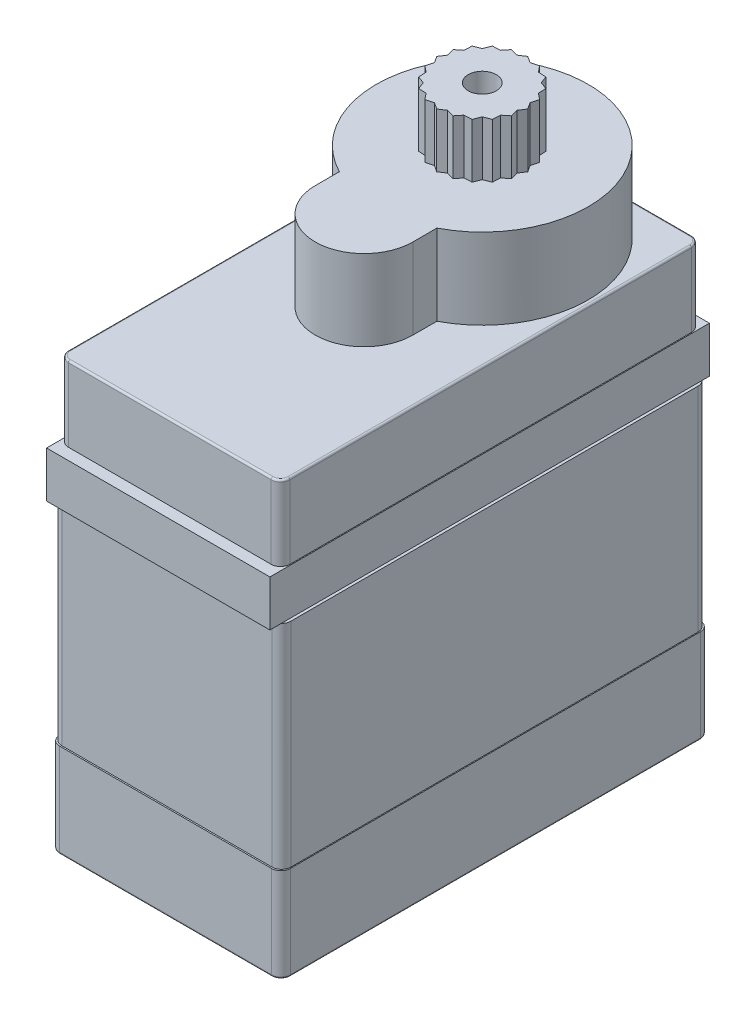
from build123d import *

# Parameters (mm, degrees)
Y_KSEKLIK_EKSTR_ZYON1_DEPTH = 5
Y_KSEKLIK_EKSTR_ZYON2_DEPTH = 11.35
Y_KSEKLIK_EKSTR_ZYON3_DEPTH = 2.45
Y_KSEKLIK_EKSTR_ZYON4_DEPTH = 4
IZIM5_R                     = 5.65
Y_KSEKLIK_EKSTR_ZYON5_DEPTH = 4.3
IZIM7_R                     = 0.75
Y_KSEKLIK_EKSTR_ZYON6_DEPTH = 2.9
RADYUS1_R                   = 0.1
IZIM8_R                     = 0.6
Y_KSEKLIK_EKSTR_ZYON7_DEPTH = 3
SKETCH1_OUTSIDE_W           = 23.446
SKETCH1_OUTSIDE_H           = 43.396
SKETCH1_OUTSIDE_W_2         = 11.9
SKETCH1_OUTSIDE_H_2         = 23.420918094
CUT_EXTRUDE1_DEPTH          = 2.45


with BuildPart() as part:
    # Çizim1 → Yükseklik-Ekstrüzyon1 (new body)
    with BuildSketch(Plane(origin=(0, 0, 0), x_dir=(1, 0, 0), z_dir=(0, 1, 0))):
        with BuildLine():
            Line((-5.65, -11.425), (5.65, -11.425))
            ThreePointArc((5.65, -11.425), (6.003553391, -11.278553391), (6.15, -10.925))
            Line((6.15, -10.925), (6.15, 10.925))
            ThreePointArc((6.15, 10.925), (6.003553391, 11.278553391), (5.65, 11.425))
            Line((5.65, 11.425), (-5.65, 11.425))
            ThreePointArc((-5.65, 11.425), (-6.003553391, 11.278553391), (-6.15, 10.925))
            Line((-6.15, 10.925), (-6.15, -10.925))
            ThreePointArc((-6.15, -10.925), (-6.003553391, -11.278553391), (-5.65, -11.425))
        make_face()
    extrude(amount=Y_KSEKLIK_EKSTR_ZYON1_DEPTH)

    # Çizim2 → Yükseklik-Ekstrüzyon2 (add)
    with BuildSketch(Plane(origin=(0, 5, 0), x_dir=(1, 0, 0), z_dir=(0, 1, 0))):
        with BuildLine():
            Line((-5.6, -11.35), (5.6, -11.35))
            ThreePointArc((5.6, -11.35), (5.953553391, -11.203553391), (6.1, -10.85))
            Line((6.1, -10.85), (6.1, 10.85))
            ThreePointArc((6.1, 10.85), (5.953553391, 11.203553391), (5.6, 11.35))
            Line((5.6, 11.35), (-5.6, 11.35))
            ThreePointArc((-5.6, 11.35), (-5.953553391, 11.203553391), (-6.1, 10.85))
            Line((-6.1, 10.85), (-6.1, -10.85))
            ThreePointArc((-6.1, -10.85), (-5.953553391, -11.203553391), (-5.6, -11.35))
        make_face()
    extrude(amount=Y_KSEKLIK_EKSTR_ZYON2_DEPTH)

    # Çizim3 → Yükseklik-Ekstrüzyon3 (add)
    with BuildSketch(Plane(origin=(0, 16.35, 0), x_dir=(1, 0, 0), z_dir=(0, 1, 0))):
        with BuildLine():
            Line((-5.95, 15.625), (-5.95, 11.207071421))
            ThreePointArc((-5.95, 11.207071421), (-5.789029481, 11.31289076), (-5.6, 11.35))
            Line((-5.6, 11.35), (5.6, 11.35))
            ThreePointArc((5.6, 11.35), (5.789029481, 11.31289076), (5.95, 11.207071421))
            Line((5.95, 11.207071421), (5.95, 15.625))
            ThreePointArc((5.95, 15.625), (5.803553391, 15.978553391), (5.45, 16.125))
            Line((5.45, 16.125), (0.5, 16.125))
            Line((0.5, 16.125), (0.5, 14.991025404))
            ThreePointArc((0.5, 14.991025404), (0, 13.125), (-0.5, 14.991025404))
            Line((-0.5, 14.991025404), (-0.5, 16.125))
            Line((-0.5, 16.125), (-5.45, 16.125))
            ThreePointArc((-5.45, 16.125), (-5.803553391, 15.978553391), (-5.95, 15.625))
        make_face()
        with BuildLine():
            Line((-5.95, 11.207071421), (-5.95, -11.207071421))
            ThreePointArc((-5.95, -11.207071421), (-5.789029481, -11.31289076), (-5.6, -11.35))
            Line((-5.6, -11.35), (5.6, -11.35))
            ThreePointArc((5.6, -11.35), (5.789029481, -11.31289076), (5.95, -11.207071421))
            Line((5.95, -11.207071421), (5.95, 11.207071421))
            ThreePointArc((5.95, 11.207071421), (5.789029481, 11.31289076), (5.6, 11.35))
            Line((5.6, 11.35), (-5.6, 11.35))
            ThreePointArc((-5.6, 11.35), (-5.789029481, 11.31289076), (-5.95, 11.207071421))
        make_face()
        with BuildLine():
            ThreePointArc((-5.95, -15.625), (-5.803553391, -15.978553391), (-5.45, -16.125))
            Line((-5.45, -16.125), (-0.5, -16.125))
            Line((-0.5, -16.125), (-0.5, -14.991025404))
            ThreePointArc((-0.5, -14.991025404), (0, -13.125), (0.5, -14.991025404))
            Line((0.5, -14.991025404), (0.5, -16.125))
            Line((0.5, -16.125), (5.45, -16.125))
            ThreePointArc((5.45, -16.125), (5.803553391, -15.978553391), (5.95, -15.625))
            Line((5.95, -15.625), (5.95, -11.207071421))
            ThreePointArc((5.95, -11.207071421), (5.789029481, -11.31289076), (5.6, -11.35))
            Line((5.6, -11.35), (-5.6, -11.35))
            ThreePointArc((-5.6, -11.35), (-5.789029481, -11.31289076), (-5.95, -11.207071421))
            Line((-5.95, -11.207071421), (-5.95, -15.625))
        make_face()
    extrude(amount=Y_KSEKLIK_EKSTR_ZYON3_DEPTH)

    # Çizim4 → Yükseklik-Ekstrüzyon4 (add)
    with BuildSketch(Plane(origin=(0, 18.8, 0), x_dir=(1, 0, 0), z_dir=(0, 1, 0))):
        with BuildLine():
            Line((-5.4, -11.2), (5.4, -11.2))
            ThreePointArc((5.4, -11.2), (5.753553391, -11.053553391), (5.9, -10.7))
            Line((5.9, -10.7), (5.9, 10.7))
            ThreePointArc((5.9, 10.7), (5.753553391, 11.053553391), (5.4, 11.2))
            Line((5.4, 11.2), (-5.4, 11.2))
            ThreePointArc((-5.4, 11.2), (-5.753553391, 11.053553391), (-5.9, 10.7))
            Line((-5.9, 10.7), (-5.9, -10.7))
            ThreePointArc((-5.9, -10.7), (-5.753553391, -11.053553391), (-5.4, -11.2))
        make_face()
    extrude(amount=Y_KSEKLIK_EKSTR_ZYON4_DEPTH)

    # Çizim5 → Yükseklik-Ekstrüzyon5 (add)
    with BuildSketch(Plane(origin=(0, 22.8, 0), x_dir=(1, 0, 0), z_dir=(0, 1, 0))):
        with Locations((0, 5.45)):
            Circle(IZIM5_R)
        with BuildLine():
            ThreePointArc((-2.6, -0.85), (0, -3.45), (2.6, -0.85))
            Line((2.6, -0.85), (2.6, 0.433776321))
            ThreePointArc((2.6, 0.433776321), (0, -0.2), (-2.6, 0.433776321))
            Line((-2.6, 0.433776321), (-2.6, -0.85))
        make_face()
    extrude(amount=Y_KSEKLIK_EKSTR_ZYON5_DEPTH)

    # Çizim7 → Yükseklik-Ekstrüzyon6 (add)
    # profile 1 of 21: a face of its own
    with BuildSketch(Plane(origin=(0, 27.1, 0), x_dir=(1, 0, 0), z_dir=(0, 1, 0))):
        Polygon((1.982489516, 6.460128862), (1.573312588, 7.023312588), (1.010128862, 7.432489516), (0.348066685, 7.647606558), (-0.348066685, 7.647606558), (-1.010128862, 7.432489516), (-1.573312588, 7.023312588), (-1.982489516, 6.460128862), (-2.197606558, 5.798066685), (-2.197606558, 5.101933315), (-1.982489516, 4.439871138), (-1.573312588, 3.876687412), (-1.010128862, 3.467510484), (-0.348066685, 3.252393442), (0.348066685, 3.252393442), (1.010128862, 3.467510484), (1.573312588, 3.876687412), (1.982489516, 4.439871138), (2.197606558, 5.101933315), (2.197606558, 5.798066685), align=None)
        with Locations(Location((0, 5.45, 0), (0, 0, 270))):
            Circle(IZIM7_R, mode=Mode.SUBTRACT)
    # profile 2 of 21: a face of its own
    with BuildSketch(Plane(origin=(0, 27.1, 0), x_dir=(1, 0, 0), z_dir=(0, 1, 0))):
        Polygon((-0.749366211, 7.756312052), (-0.348066685, 7.647606558), (-1.010128862, 7.432489516), align=None)
    # profile 3 of 21: a face of its own
    with BuildSketch(Plane(origin=(0, 27.1, 0), x_dir=(1, 0, 0), z_dir=(0, 1, 0))):
        Polygon((0, 7.875), (0.348066685, 7.647606558), (-0.348066685, 7.647606558), align=None)
    # profile 4 of 21: a face of its own
    with BuildSketch(Plane(origin=(0, 27.1, 0), x_dir=(1, 0, 0), z_dir=(0, 1, 0))):
        Polygon((-1.425379237, 7.411866211), (-1.010128862, 7.432489516), (-1.573312588, 7.023312588), align=None)
    # profile 5 of 21: a face of its own
    with BuildSketch(Plane(origin=(0, 27.1, 0), x_dir=(1, 0, 0), z_dir=(0, 1, 0))):
        Polygon((-1.961866211, 6.875379237), (-1.573312588, 7.023312588), (-1.982489516, 6.460128862), align=None)
    # profile 6 of 21: a face of its own
    with BuildSketch(Plane(origin=(0, 27.1, 0), x_dir=(1, 0, 0), z_dir=(0, 1, 0))):
        Polygon((-2.306312052, 6.199366211), (-1.982489516, 6.460128862), (-2.197606558, 5.798066685), align=None)
    # profile 7 of 21: a face of its own
    with BuildSketch(Plane(origin=(0, 27.1, 0), x_dir=(1, 0, 0), z_dir=(0, 1, 0))):
        Polygon((-2.306312052, 4.700633789), (-2.197606558, 5.101933315), (-1.982489516, 4.439871138), align=None)
    # profile 8 of 21: a face of its own
    with BuildSketch(Plane(origin=(0, 27.1, 0), x_dir=(1, 0, 0), z_dir=(0, 1, 0))):
        Polygon((-2.425, 5.45), (-2.197606558, 5.798066685), (-2.197606558, 5.101933315), align=None)
    # profile 9 of 21: a face of its own
    with BuildSketch(Plane(origin=(0, 27.1, 0), x_dir=(1, 0, 0), z_dir=(0, 1, 0))):
        Polygon((-1.961866211, 4.024620763), (-1.982489516, 4.439871138), (-1.573312588, 3.876687412), align=None)
    # profile 10 of 21: a face of its own
    with BuildSketch(Plane(origin=(0, 27.1, 0), x_dir=(1, 0, 0), z_dir=(0, 1, 0))):
        Polygon((-1.425379237, 3.488133789), (-1.573312588, 3.876687412), (-1.010128862, 3.467510484), align=None)
    # profile 11 of 21: a face of its own
    with BuildSketch(Plane(origin=(0, 27.1, 0), x_dir=(1, 0, 0), z_dir=(0, 1, 0))):
        Polygon((-0.749366211, 3.143687948), (-1.010128862, 3.467510484), (-0.348066685, 3.252393442), align=None)
    # profile 12 of 21: a face of its own
    with BuildSketch(Plane(origin=(0, 27.1, 0), x_dir=(1, 0, 0), z_dir=(0, 1, 0))):
        Polygon((0, 3.025), (-0.348066685, 3.252393442), (0.348066685, 3.252393442), align=None)
    # profile 13 of 21: a face of its own
    with BuildSketch(Plane(origin=(0, 27.1, 0), x_dir=(1, 0, 0), z_dir=(0, 1, 0))):
        Polygon((0.749366211, 3.143687948), (0.348066685, 3.252393442), (1.010128862, 3.467510484), align=None)
    # profile 14 of 21: a face of its own
    with BuildSketch(Plane(origin=(0, 27.1, 0), x_dir=(1, 0, 0), z_dir=(0, 1, 0))):
        Polygon((0.749366211, 7.756312052), (1.010128862, 7.432489516), (0.348066685, 7.647606558), align=None)
    # profile 15 of 21: a face of its own
    with BuildSketch(Plane(origin=(0, 27.1, 0), x_dir=(1, 0, 0), z_dir=(0, 1, 0))):
        Polygon((1.425379237, 7.411866211), (1.573312588, 7.023312588), (1.010128862, 7.432489516), align=None)
    # profile 16 of 21: a face of its own
    with BuildSketch(Plane(origin=(0, 27.1, 0), x_dir=(1, 0, 0), z_dir=(0, 1, 0))):
        Polygon((1.961866211, 6.875379237), (1.982489516, 6.460128862), (1.573312588, 7.023312588), align=None)
    # profile 17 of 21: a face of its own
    with BuildSketch(Plane(origin=(0, 27.1, 0), x_dir=(1, 0, 0), z_dir=(0, 1, 0))):
        Polygon((2.306312052, 6.199366211), (2.197606558, 5.798066685), (1.982489516, 6.460128862), align=None)
    # profile 18 of 21: a face of its own
    with BuildSketch(Plane(origin=(0, 27.1, 0), x_dir=(1, 0, 0), z_dir=(0, 1, 0))):
        Polygon((2.425, 5.45), (2.197606558, 5.101933315), (2.197606558, 5.798066685), align=None)
    # profile 19 of 21: a face of its own
    with BuildSketch(Plane(origin=(0, 27.1, 0), x_dir=(1, 0, 0), z_dir=(0, 1, 0))):
        Polygon((2.306312052, 4.700633789), (1.982489516, 4.439871138), (2.197606558, 5.101933315), align=None)
    # profile 20 of 21: a face of its own
    with BuildSketch(Plane(origin=(0, 27.1, 0), x_dir=(1, 0, 0), z_dir=(0, 1, 0))):
        Polygon((1.961866211, 4.024620763), (1.573312588, 3.876687412), (1.982489516, 4.439871138), align=None)
    # profile 21 of 21: a face of its own
    with BuildSketch(Plane(origin=(0, 27.1, 0), x_dir=(1, 0, 0), z_dir=(0, 1, 0))):
        Polygon((1.425379237, 3.488133789), (1.010128862, 3.467510484), (1.573312588, 3.876687412), align=None)
    extrude(amount=Y_KSEKLIK_EKSTR_ZYON6_DEPTH)

    # Radyus1
    radyus1_edges = [part.edges().sort_by_distance(p)[0] for p in [
        (0, 22.8, -11.2),
        (-5.753553391, 22.8, -11.053553391),
        (-5.9, 22.8, 0),
        (-5.753553391, 22.8, 11.053553391),
        (0, 0, 11.425),
        (0, 22.8, 11.2),
        (-6.003553391, 0, 11.278553391),
        (-6.15, 0, 0),
        (-6.003553391, 0, -11.278553391),
        (0, 0, -11.425),
        (6.003553391, 0, -11.278553391),
        (6.15, 0, 0),
        (6.003553391, 0, 11.278553391),
        (5.753553391, 22.8, 11.053553391),
        (5.9, 22.8, 0),
        (5.753553391, 22.8, -11.053553391),
    ]]
    fillet(radyus1_edges, radius=RADYUS1_R - 0.0001)  # a hair under: the kernel refuses the full size

    # Çizim8 → Yükseklik-Ekstrüzyon7 (add)
    with BuildSketch(Plane(origin=(0, 0, -11.425), x_dir=(-1, 0, 0), z_dir=(0, 0, -1))):
        with Locations(Location((-1.25, 4.4, 0), (0, 0, 90))):
            Circle(IZIM8_R)
        with Locations(Location((0, 4.4, 0), (0, 0, 90))):
            Circle(IZIM8_R)
        with Locations(Location((1.25, 4.4, 0), (0, 0, 90))):
            Circle(IZIM8_R)
    extrude(amount=Y_KSEKLIK_EKSTR_ZYON7_DEPTH)

    # Sketch1 outside → Cut-Extrude1 (cut)
    with BuildSketch(Plane(origin=(0, 18.8, 0), x_dir=(1, 0, 0), z_dir=(0, 1, 0))):
        Rectangle(SKETCH1_OUTSIDE_W, SKETCH1_OUTSIDE_H)
        with Locations((0, -0.105309884)):
            Rectangle(SKETCH1_OUTSIDE_W_2, SKETCH1_OUTSIDE_H_2, mode=Mode.SUBTRACT)
    extrude(amount=-CUT_EXTRUDE1_DEPTH, mode=Mode.SUBTRACT)


solid = part.part
